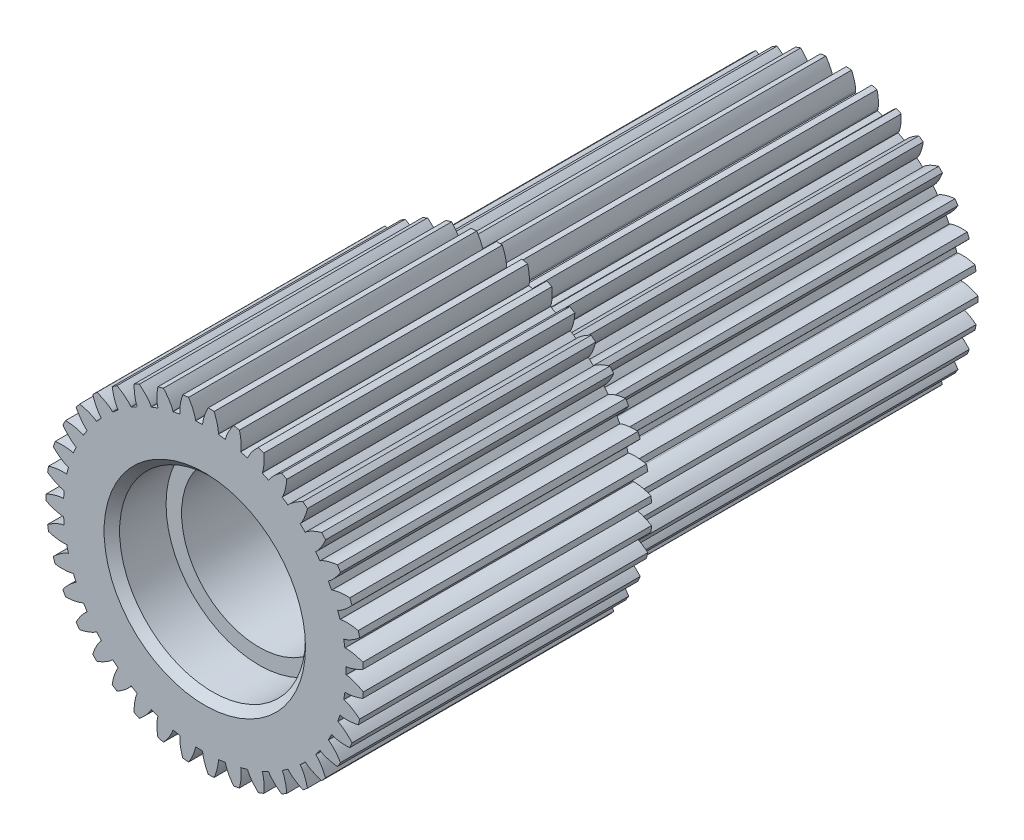
from build123d import *

# Parameters (mm, degrees)
SKETCH1_R           = 10.25
BOSS_EXTRUDE1_DEPTH = 9.30130544
CUT_EXTRUDE1_DEPTH  = 18.223219295
CIRPATTERN2_COUNT   = 39
SKETCH4_R           = 8.75
BOSS_EXTRUDE2_DEPTH = 22.55792586
CUT_EXTRUDE2_START  = -22.55792586
CUT_EXTRUDE2_DEPTH  = 22.55792586
CIRPATTERN3_COUNT   = 33
SKETCH3_R           = 5
CUT_EXTRUDE3_DEPTH  = 44.637885203
SKETCH7_R           = 6
CUT_EXTRUDE4_DEPTH  = 3.5
CHAMFER1_SIZE       = 0.5


with BuildPart() as part:
    # Sketch1 → Boss-Extrude1 (new, symmetric)
    with BuildSketch(Plane.XY):
        Circle(SKETCH1_R)
    extrude(amount=BOSS_EXTRUDE1_DEPTH, both=True)

    # Sketch2 → Cut-Extrude1 (cut, symmetric)
    with BuildSketch(Plane.XY):
        with BuildLine():
            Line((9.122062998, -0.231498721), (9.156598683, -0.232375163))
            add(Edge.make_bspline(
                [(9.156598683, -0.232375163), (9.159728598, -0.232499669), (9.168501485, -0.232988318), (9.185061266, -0.234462661), (9.212027105, -0.237649184), (9.261990302, -0.245241196), (9.321658144, -0.257108506), (9.388681282, -0.273218977), (9.460286845, -0.293230089), (9.521217164, -0.312007973), (9.581701249, -0.332286675), (9.641668963, -0.353878984), (9.713946876, -0.381670864), (9.800094345, -0.417267072), (9.899958937, -0.462159236), (10.01218921, -0.51693474), (10.109815941, -0.568615313), (10.177732365, -0.606513275), (10.217779364, -0.629625443), (10.230195713, -0.636863941)],
                knots=[0, 0, 0, 0, 0, 0.005376749, 0.015083688, 0.02853182, 0.04661014, 0.092110525, 0.119476176, 0.146842496, 0.174208854, 0.201574956, 0.228941013, 0.256307345, 0.307035032, 0.361767352, 0.416499661, 0.471231937, 0.495873875, 0.495873875, 0.495873875, 0.495873875, 0.495873875], degree=4))
            ThreePointArc((10.230195713, -0.636863941), (10.245047732, -0.318585895), (10.25, 0))
            ThreePointArc((10.25, 0), (10.245068269, 0.317924785), (10.230277821, 0.635543634))
            add(Edge.make_bspline(
                [(9.159054143, 0.232437478), (9.162184058, 0.232561984), (9.170956945, 0.233050633), (9.187516726, 0.234524976), (9.214482565, 0.237711499), (9.264445762, 0.24530351), (9.324113604, 0.25717082), (9.391136742, 0.273281292), (9.462742306, 0.293292403), (9.523672624, 0.312070288), (9.584156709, 0.33234899), (9.644124424, 0.353941298), (9.716402336, 0.381733178), (9.802549805, 0.417329386), (9.902414397, 0.46222155), (10.014644671, 0.516997055), (10.111662678, 0.568355388), (10.178995109, 0.605910197), (10.218452533, 0.628659658), (10.230277821, 0.635543634)],
                knots=[0, 0, 0, 0, 0, 0.005376749, 0.015083688, 0.02853182, 0.04661014, 0.092110525, 0.119476176, 0.146842496, 0.174208854, 0.201574956, 0.228941013, 0.256307345, 0.307035032, 0.361767352, 0.416499661, 0.471231937, 0.494696426, 0.494696426, 0.494696426, 0.494696426, 0.494696426], degree=4))
            Line((9.159054143, 0.232437478), (9.122062998, 0.231498721))
            ThreePointArc((9.122062998, 0.231498721), (9.12426572, 0.115758675), (9.125, 0))
            ThreePointArc((9.125, 0), (9.12426572, -0.115758675), (9.122062998, -0.231498721))
        make_face()
    cut_extrude1 = extrude(amount=CUT_EXTRUDE1_DEPTH, both=True, mode=Mode.SUBTRACT)

    # CirPattern2: Cut-Extrude1 ×39 about axis
    cirpattern2_axis = Axis((0, 0, 9.30130544), (0, 0, -1))
    for i in range(1, CIRPATTERN2_COUNT):
        add(cut_extrude1.rotate(cirpattern2_axis, i * 360 / CIRPATTERN2_COUNT), mode=Mode.SUBTRACT)

    # Sketch4 → Boss-Extrude2 (add)
    with BuildSketch(Plane(origin=(0, 0, -9.30130544), x_dir=(-1, 0, 0), z_dir=(0, 0, -1))):
        with Locations(Location((0, 0, 0), (0, 0, 180))):
            Circle(SKETCH4_R)
    extrude(amount=BOSS_EXTRUDE2_DEPTH)

    # Sketch5 → Cut-Extrude2 (cut)
    with BuildSketch(Plane(origin=(0, 0, -31.8592313), x_dir=(-1, 0, 0), z_dir=(0, 0, -1)).offset(CUT_EXTRUDE2_START)):
        with BuildLine():
            add(Edge.make_bspline(
                [(7.728222665, 0.252768217), (7.730870212, 0.25289296), (7.738290197, 0.253360781), (7.761165137, 0.255566328), (7.806119953, 0.262054914), (7.861296747, 0.273125697), (7.9243419, 0.288765513), (7.984805601, 0.306141233), (8.036244287, 0.322407333), (8.087296102, 0.339940558), (8.137902859, 0.358582065), (8.198887244, 0.382545502), (8.271558734, 0.413198365), (8.355779108, 0.451801823), (8.450401229, 0.498844505), (8.545797633, 0.55024227), (8.625730164, 0.596147304), (8.682352975, 0.630568681), (8.715277942, 0.651108137), (8.725270047, 0.657390758)],
                knots=[0, 0, 0, 0, 0, 0.005376749, 0.015083688, 0.04661014, 0.092110525, 0.119476176, 0.146842496, 0.174208854, 0.201574956, 0.228941013, 0.256307345, 0.307035032, 0.361767352, 0.416499661, 0.471231937, 0.525964282, 0.549956554, 0.549956554, 0.549956554, 0.549956554, 0.549956554], degree=4))
            Line((7.728222665, 0.252768217), (7.620924816, 0.249258809))
            ThreePointArc((7.620924816, 0.249258809), (7.623981136, 0.12464606), (7.625, 0))
            ThreePointArc((7.625, 0), (7.623981136, -0.12464606), (7.620924816, -0.249258809))
            Line((7.620924816, -0.249258809), (7.728222665, -0.252768217))
            add(Edge.make_bspline(
                [(7.728222665, -0.252768217), (7.730870212, -0.25289296), (7.738290197, -0.253360781), (7.761165137, -0.255566328), (7.806119953, -0.262054914), (7.861296747, -0.273125697), (7.9243419, -0.288765513), (7.984805601, -0.306141233), (8.036244287, -0.322407333), (8.087296102, -0.339940558), (8.137902859, -0.358582065), (8.198887244, -0.382545502), (8.271558734, -0.413198365), (8.355779108, -0.451801823), (8.450401229, -0.498844505), (8.545797633, -0.55024227), (8.625730164, -0.596147304), (8.682352975, -0.630568681), (8.715277942, -0.651108137), (8.725270047, -0.657390758)],
                knots=[0, 0, 0, 0, 0, 0.005376749, 0.015083688, 0.04661014, 0.092110525, 0.119476176, 0.146842496, 0.174208854, 0.201574956, 0.228941013, 0.256307345, 0.307035032, 0.361767352, 0.416499661, 0.471231937, 0.525964282, 0.549956554, 0.549956554, 0.549956554, 0.549956554, 0.549956554], degree=4))
            ThreePointArc((8.725270047, -0.657390758), (8.743815326, -0.328927872), (8.75, 0))
            ThreePointArc((8.75, 0), (8.743815326, 0.328927872), (8.725270047, 0.657390758))
        make_face()
    cut_extrude2 = extrude(amount=CUT_EXTRUDE2_DEPTH, mode=Mode.SUBTRACT)

    # CirPattern3: Cut-Extrude2 ×33 about axis
    cirpattern3_axis = Axis((0, 0, -31.8592313), (0, 0, 1))
    for i in range(1, CIRPATTERN3_COUNT):
        add(cut_extrude2.rotate(cirpattern3_axis, i * 360 / CIRPATTERN3_COUNT), mode=Mode.SUBTRACT)

    # Sketch3 → Cut-Extrude3 (cut, through all)
    with BuildSketch(Plane.XY.offset(9.30130544)):
        Circle(SKETCH3_R)
    extrude(amount=-CUT_EXTRUDE3_DEPTH, mode=Mode.SUBTRACT)

    # Sketch7 → Cut-Extrude4 (cut)
    with BuildSketch(Plane(origin=(0, 0, -31.8592313), x_dir=(-1, 0, 0), z_dir=(0, 0, -1))):
        Circle(SKETCH7_R)
    cut_extrude4 = extrude(amount=-CUT_EXTRUDE4_DEPTH, mode=Mode.SUBTRACT)

    # Mirror1: Cut-Extrude4 across plane
    add(cut_extrude4.mirror(Plane(origin=(0, 0, -11.27896293), x_dir=(1, 0, 0), z_dir=(0, 0, -1))), mode=Mode.SUBTRACT)

    # Chamfer1
    chamfer1_edges = [part.edges().sort_by_distance(p)[0] for p in [
        (6, 0, -31.8592313),
        (6, 0, 9.30130544),
    ]]
    chamfer(chamfer1_edges, length=CHAMFER1_SIZE)


solid = part.part
